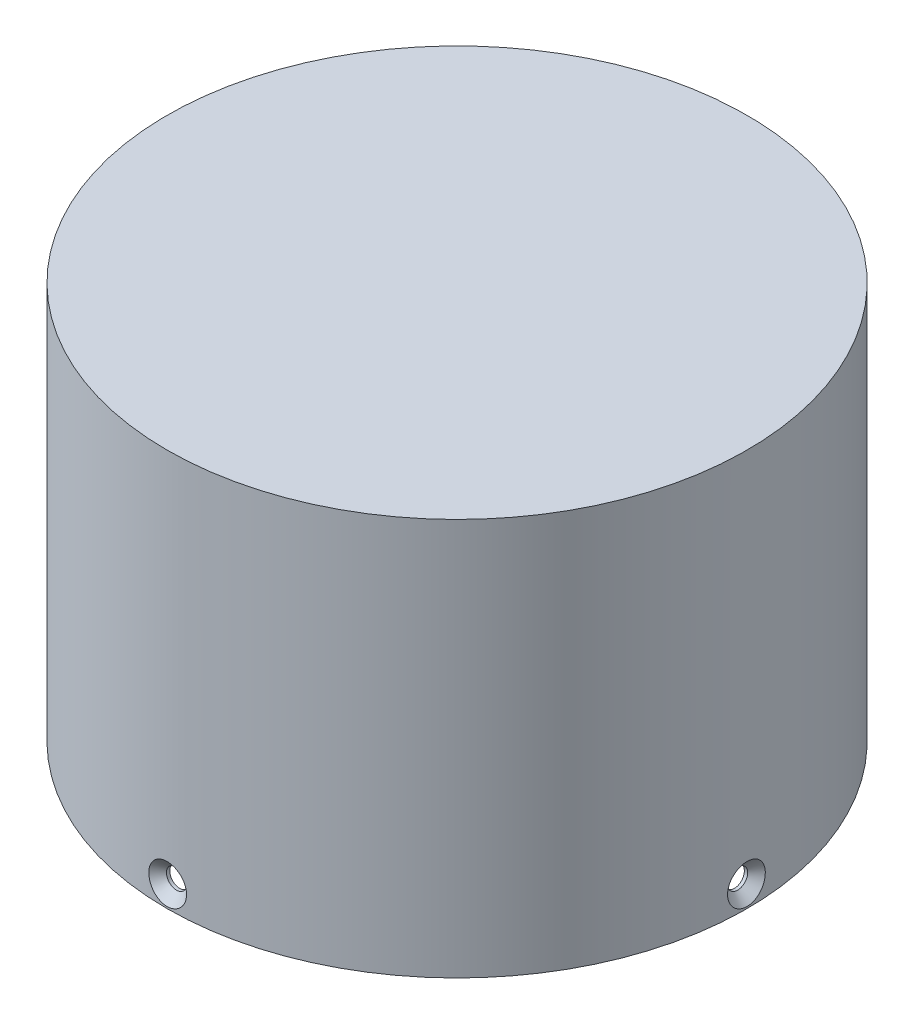
from build123d import *

# Parameters (mm, degrees)
SKETCH3_R           = 23.075
BOSS_EXTRUDE3_DEPTH = 31.6
SKETCH4_R           = 22.075
CUT_EXTRUDE1_DEPTH  = 30.6
CIRPATTERN1_COUNT   = 4


# Read off the part's stored shape, not the designer's step: CSK for M2 Flat Head Machine Screw2
with BuildPart() as part:
    # Sketch3 → Boss-Extrude3 (new body)
    with BuildSketch(Plane(origin=(0, 0, 0), x_dir=(1, 0, 0), z_dir=(0, 1, 0))):
        with Locations(Location((0, 0, 0), (0, 0, 270))):
            Circle(SKETCH3_R)
    extrude(amount=BOSS_EXTRUDE3_DEPTH)

    # Sketch4 → Cut-Extrude1 (cut)
    with BuildSketch(Plane.XZ):
        with Locations(Location((0, 0, 0), (0, 0, 270))):
            Circle(SKETCH4_R)
    extrude(amount=-CUT_EXTRUDE1_DEPTH, mode=Mode.SUBTRACT)

    # CSK for M2 Flat Head Machine Screw2 outl → CSK for M2 Flat Head Machine Screw2 (revolve, cut)
    with BuildSketch(Plane(origin=(0, 1.7, 0), x_dir=(0, 1, 0), z_dir=(0, 0, -1))):
        Polygon((1.550011104, 23.075011104), (0, 23.075011104), (0, 22.060491405), (0.8, 22.060491405), (0.8, 22.325), align=None)
    csk_for_m2_flat_head_machine_screw2 = revolve(axis=Axis((0, 1.7, 0), (1, 0, 0)), mode=Mode.SUBTRACT)

    # CirPattern1: CSK for M2 Flat Head Machine Screw2 ×4 about axis
    cirpattern1_axis = Axis((0, 30.6, 0), (0, -1, 0))
    for i in range(1, CIRPATTERN1_COUNT):
        add(csk_for_m2_flat_head_machine_screw2.rotate(cirpattern1_axis, i * 360 / CIRPATTERN1_COUNT), mode=Mode.SUBTRACT)


solid = part.part
